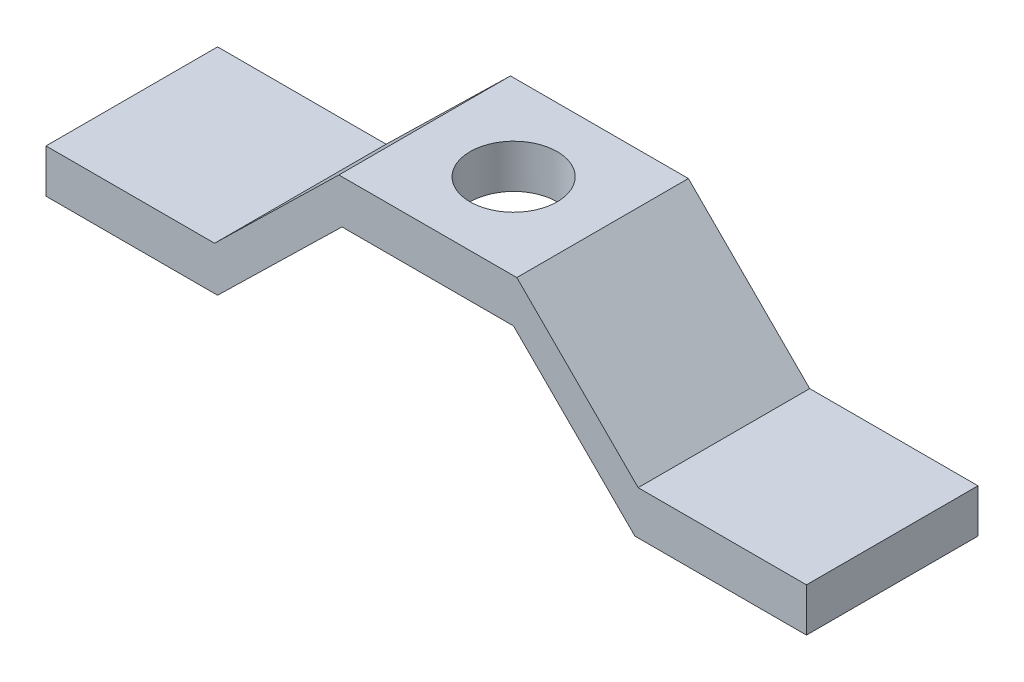
from build123d import *

# Parameters (mm, degrees)
BOSS_EXTRUDE2_DEPTH = 20
SKETCH4_R           = 5.08
CUT_EXTRUDE1_DEPTH  = 5.08


with BuildPart() as part:
    # Sketch3 → Boss-Extrude2 (new body)
    with BuildSketch(Plane.XY):
        Polygon((-65.825212984, -43.723523227), (-51.332239114, -29.583523227), (-30.589177018, -29.570613422), (-16.444906093, -43.710613422), (3.173966824, -43.710613422), (3.173966824, -48.790613422), (-16.826033176, -48.790613422), (-30.970304101, -34.650613422), (-50.970304101, -34.650613422), (-65.476510039, -48.803523227), (-85.476510039, -48.803523227), (-85.476510039, -43.723523227), align=None)
    extrude(amount=BOSS_EXTRUDE2_DEPTH)

    # Sketch4 → Cut-Extrude1 (cut)
    with BuildSketch(Plane(origin=(0.018391929, -29.55156427, 0), x_dir=(0.9999998063294889, 0.0006223672425663053, 0), z_dir=(-0.0006223672425663053, 0.999999806329489, 0))):
        with Locations((-40.979107932, -10)):
            Circle(SKETCH4_R)
    extrude(amount=-CUT_EXTRUDE1_DEPTH, mode=Mode.SUBTRACT)


solid = part.part
